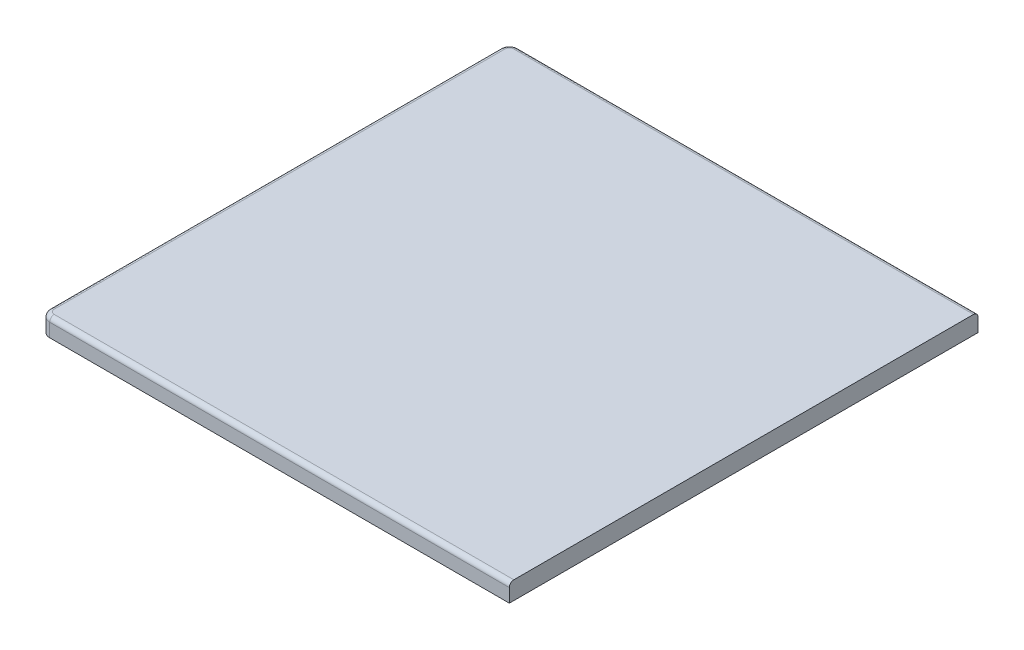
from build123d import *

# Parameters (mm, degrees)
SCHIZZO1_W                   = 104
SCHIZZO1_H                   = 104
ESTRUSIONE_ESTRUSIONE1_DEPTH = 4
SCHIZZO2_W                   = 100
SCHIZZO2_H                   = 100
TAGLIO_ESTRUSIONE2_DEPTH     = 3
RACCORDO1_R                  = 1
RACCORDO2_R                  = 2


with BuildPart() as part:
    # Schizzo1 → Estrusione-Estrusione1 (new body)
    with BuildSketch(Plane(origin=(0, 0, 0), x_dir=(1, 0, 0), z_dir=(0, 1, 0))):
        Rectangle(SCHIZZO1_W, SCHIZZO1_H)
    extrude(amount=ESTRUSIONE_ESTRUSIONE1_DEPTH)

    # Schizzo2 → Taglio-Estrusione2 (cut)
    with BuildSketch(Plane(origin=(0, 0, 0), x_dir=(1, 0, 0), z_dir=(0, 1, 0))):
        Rectangle(SCHIZZO2_W, SCHIZZO2_H)
    extrude(amount=TAGLIO_ESTRUSIONE2_DEPTH, mode=Mode.SUBTRACT)

    # Raccordo1
    raccordo1_edges = [part.edges().sort_by_distance(p)[0] for p in [
        (0, 4, -52),
        (-52, 4, 0),
        (0, 4, 52),
    ]]
    fillet(raccordo1_edges, radius=RACCORDO1_R)

    # Raccordo2
    # the kernel refuses this fillet: 2 mm, written as the material it takes off along each edge
    with BuildSketch(Plane(origin=(-50, 4, -50), x_dir=(0, 0, -1), z_dir=(1, 0, 0))) as raccordo2_piece_1:
        with BuildLine():
            CenterArc((1, -1), 1, 0, 90)
            Line((2, -1), (2, 0))
            Line((2, 0), (1, 0))
        make_face()
    revolve(axis=Axis((-50, 4, -50), (0, 1, 0)), revolution_arc=90, mode=Mode.SUBTRACT)
    with BuildSketch(Plane(origin=(-50, 4, 50), x_dir=(-1, 0, 0), z_dir=(0, 0, -1))) as raccordo2_piece_2:
        with BuildLine():
            CenterArc((1, -1), 1, 0, 90)
            Line((2, -1), (2, 0))
            Line((2, 0), (1, 0))
        make_face()
    revolve(axis=Axis((-50, 4, 50), (0, 1, 0)), revolution_arc=90, mode=Mode.SUBTRACT)
    with BuildSketch(Plane(origin=(-52, -5, 52), x_dir=(1, 0, 0), z_dir=(0, 1, 0)), Plane(origin=(-52, -5, -52), x_dir=(0, 0, 1), z_dir=(0, 1, 0))) as raccordo2_piece_3:
        with BuildLine():
            CenterArc((RACCORDO2_R, RACCORDO2_R), RACCORDO2_R, 180, 90)
            Line((0, RACCORDO2_R), (0, 0))
            Line((0, 0), (RACCORDO2_R, 0))
        make_face()
    extrude(amount=9, mode=Mode.SUBTRACT)


solid = part.part
